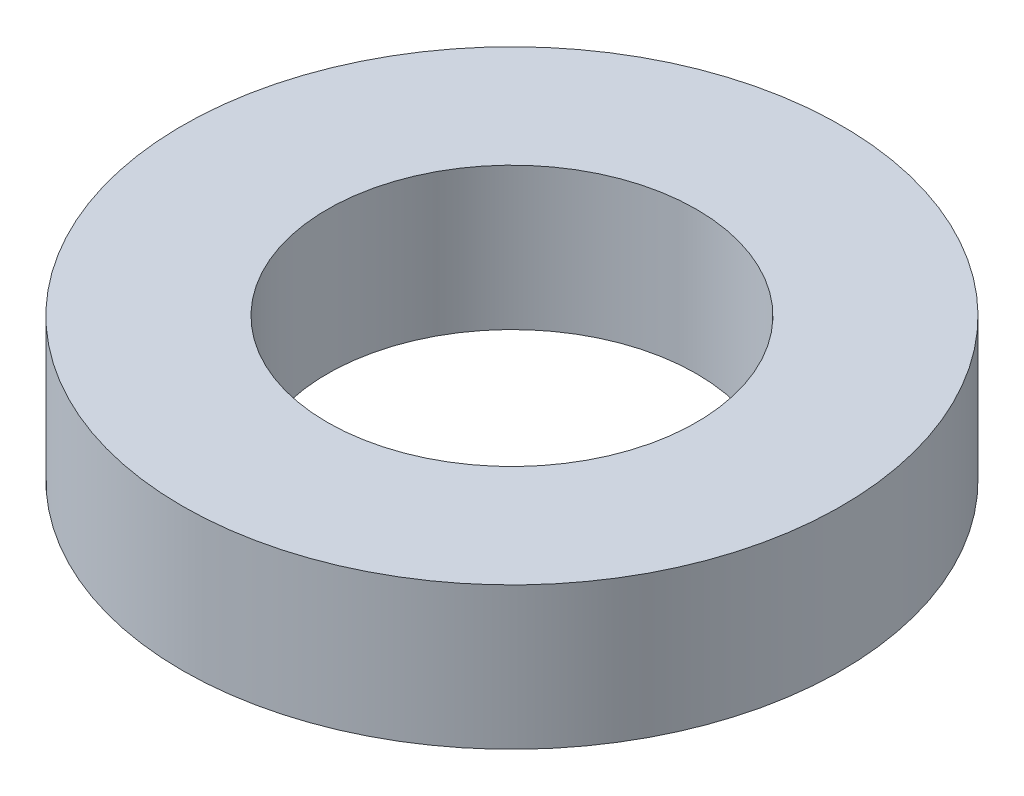
from build123d import *

# Parameters (mm, degrees)
SKETCH1_R           = 62.5
BOSS_EXTRUDE1_DEPTH = 27
SKETCH2_R           = 35
CUT_EXTRUDE1_DEPTH  = 93.420235879


with BuildPart() as part:
    # Sketch1 → Boss-Extrude1 (new body)
    with BuildSketch(Plane(origin=(0, 0, 0), x_dir=(1, 0, 0), z_dir=(0, 1, 0))):
        Circle(SKETCH1_R)
    extrude(amount=BOSS_EXTRUDE1_DEPTH)

    # Sketch2 → Cut-Extrude1 (cut, through all)
    with BuildSketch(Plane(origin=(0, 0, 0), x_dir=(1, 0, 0), z_dir=(0, 1, 0))):
        Circle(SKETCH2_R)
    extrude(amount=CUT_EXTRUDE1_DEPTH, mode=Mode.SUBTRACT)


solid = part.part
